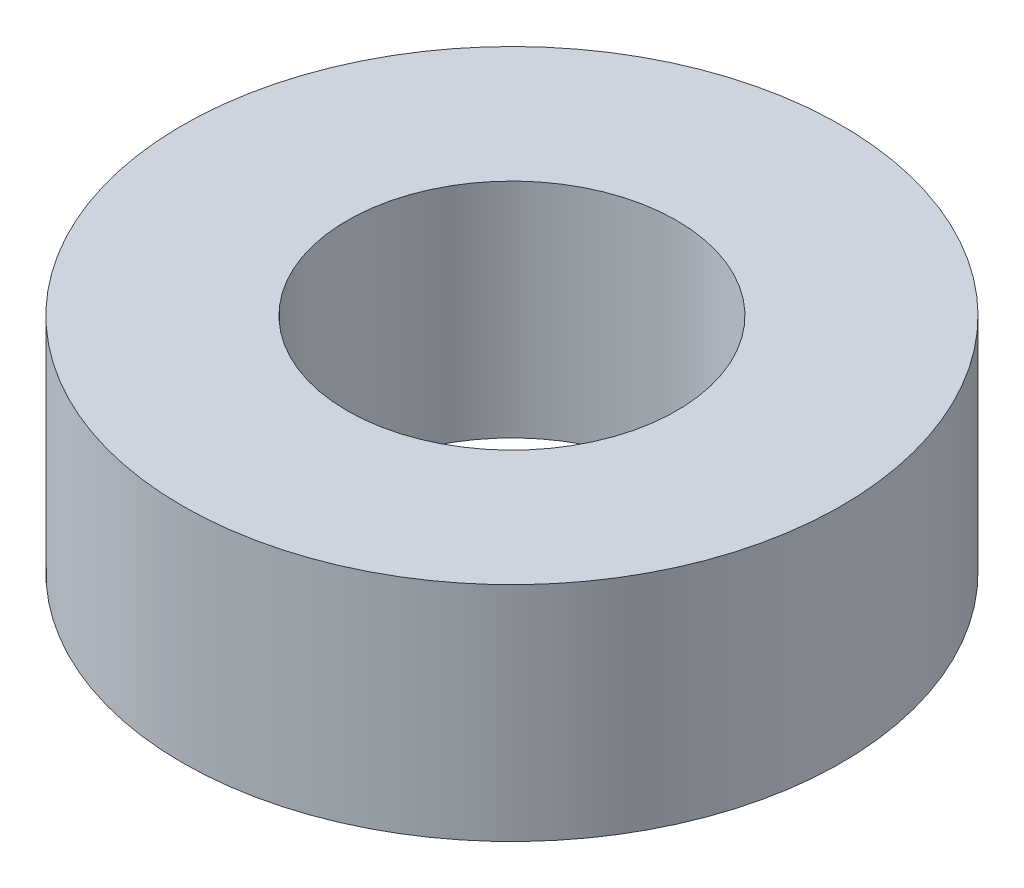
from build123d import *

# Parameters (mm, degrees)
SKETCH1_R           = 40
BOSS_EXTRUDE1_DEPTH = 27
SKETCH2_R           = 20
CUT_EXTRUDE1_DEPTH  = 63.681735777


with BuildPart() as part:
    # Sketch1 → Boss-Extrude1 (new body)
    with BuildSketch(Plane(origin=(0, 0, 0), x_dir=(1, 0, 0), z_dir=(0, 1, 0))):
        Circle(SKETCH1_R)
    extrude(amount=BOSS_EXTRUDE1_DEPTH)

    # Sketch2 → Cut-Extrude1 (cut, through all)
    with BuildSketch(Plane(origin=(0, 0, 0), x_dir=(1, 0, 0), z_dir=(0, 1, 0))):
        Circle(SKETCH2_R)
    extrude(amount=CUT_EXTRUDE1_DEPTH, mode=Mode.SUBTRACT)


solid = part.part
